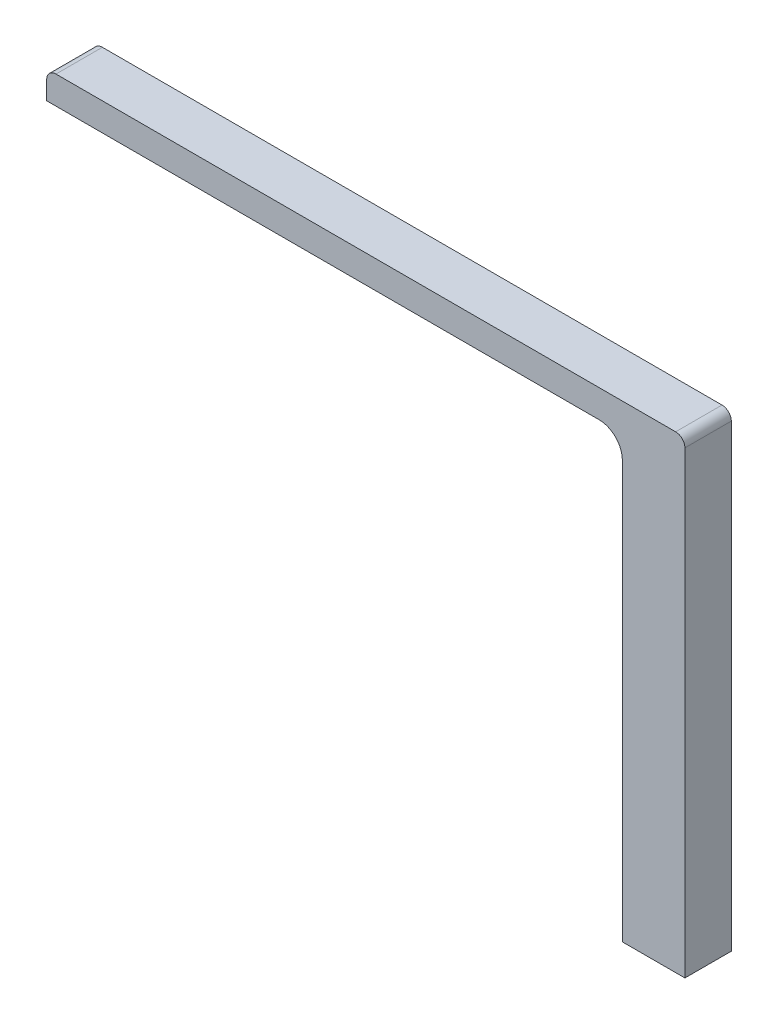
from build123d import *

# Parameters (mm, degrees)
BOSS_EXTRUDE1_DEPTH = 12.7
FILLET1_R           = 6.35
FILLET2_R           = 2.54
SKETCH2_W           = 21.1074
SKETCH2_H           = 120.65
CUT_EXTRUDE1_DEPTH  = 110.139237274


with BuildPart() as part:
    # Sketch1 → Boss-Extrude1 (new body)
    with BuildSketch(Plane.XY):
        Polygon((70.2437, -64.135), (87.3887, -64.135), (87.3887, 64.135), (-87.3887, 64.135), (-87.3887, -64.135), (-72.6313, -64.135), (-72.6313, 56.515), (70.2437, 56.515), align=None)
    extrude(amount=BOSS_EXTRUDE1_DEPTH)

    # Fillet1
    fillet1_edges = [part.edges().sort_by_distance(p)[0] for p in [
        (-72.6313, 56.515, 6.35),
        (70.2437, 56.515, 6.35),
    ]]
    fillet(fillet1_edges, radius=FILLET1_R)

    # Fillet2
    fillet2_edges = [part.edges().sort_by_distance(p)[0] for p in [
        (-87.3887, 64.135, 6.35),
        (87.3887, 64.135, 6.35),
    ]]
    fillet(fillet2_edges, radius=FILLET2_R)

    # Sketch2 → Cut-Extrude1 (cut, through all)
    with BuildSketch(Plane(origin=(0, 0, 0), x_dir=(-1, 0, 0), z_dir=(0, 0, -1))):
        with Locations((76.835, -3.81)):
            Rectangle(SKETCH2_W, SKETCH2_H)
    extrude(amount=-CUT_EXTRUDE1_DEPTH, mode=Mode.SUBTRACT)


solid = part.part
